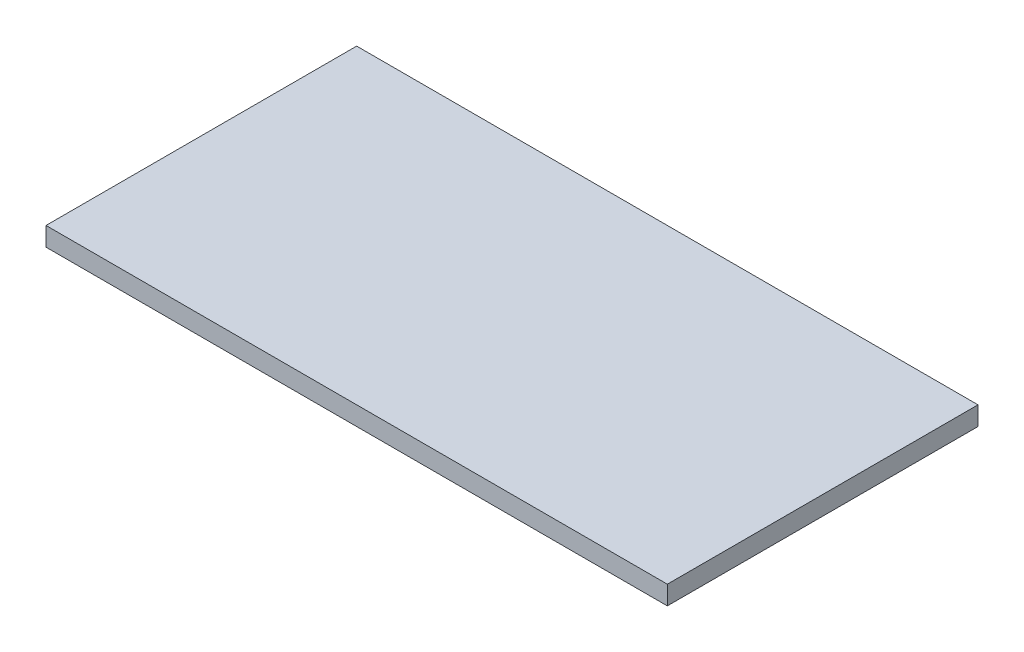
from build123d import *

# Parameters (mm, degrees)
BOSS_EXTRUDE1_DEPTH      = 3
BOSS_EXTRUDE1_DEPTH_BACK = 4
SKETCH1_W                = 15
SKETCH1_H                = 10
SKETCH2_R                = 2.3
CUT_EXTRUDE3_DEPTH       = 10
SKETCH2_4_R              = 3.025
SKETCH2_4_R_2            = 2.3
CUT_EXTRUDE4_DEPTH       = 2.6
CUT_EXTRUDE5_START       = 6.44
SKETCH2_5_R              = 3.025
SKETCH2_5_R_2            = 2.3
CUT_EXTRUDE5_DEPTH       = 3.56
SKETCH3_W                = 66
SKETCH3_H                = 33
BOSS_EXTRUDE2_DEPTH      = 2
FILLET2_R                = 3
FILLET3_R                = 3


with BuildPart() as part:
    # Sketch1 → Boss-Extrude1 (new, two sides: drawn at the far end of the back side and taken through both)
    with BuildSketch(Plane(origin=(0, 0, 0), x_dir=(1, 0, 0), z_dir=(0, 1, 0)).offset(-BOSS_EXTRUDE1_DEPTH_BACK)):
        with Locations((7.5, 0)):
            Rectangle(SKETCH1_W, SKETCH1_H)
    extrude(amount=BOSS_EXTRUDE1_DEPTH + BOSS_EXTRUDE1_DEPTH_BACK)

    # Sketch2 → Cut-Extrude3 (cut)
    with BuildSketch(Plane(origin=(0, 0, 0), x_dir=(0, 0, -1), z_dir=(1, 0, 0))):
        Circle(SKETCH2_R)
    extrude(amount=CUT_EXTRUDE3_DEPTH, mode=Mode.SUBTRACT)

    # Sketch2<4> → Cut-Extrude4 (cut)
    with BuildSketch(Plane(origin=(0, 0, 0), x_dir=(0, 0, -1), z_dir=(1, 0, 0))):
        Circle(SKETCH2_4_R)
        Circle(SKETCH2_4_R_2, mode=Mode.SUBTRACT)
    extrude(amount=CUT_EXTRUDE4_DEPTH, mode=Mode.SUBTRACT)

    # Sketch2<5> → Cut-Extrude5 (cut)
    with BuildSketch(Plane(origin=(0, 0, 0), x_dir=(0, 0, -1), z_dir=(1, 0, 0)).offset(CUT_EXTRUDE5_START)):
        Circle(SKETCH2_5_R)
        Circle(SKETCH2_5_R_2, mode=Mode.SUBTRACT)
    extrude(amount=CUT_EXTRUDE5_DEPTH, mode=Mode.SUBTRACT)

    # Fillet1: read off the stored shape, not the designer's step
    # Fillet1 outline → Fillet1 (revolve, cut)
    with BuildSketch(Plane.YX):
        with BuildLine():
            Line((2.3, 2.6), (3.025000061, 2.599999982))
            ThreePointArc((3.025000061, 2.599999982), (2.501564048, 2.959364472), (2.3, 3.561444226))
            Line((2.3, 3.561444226), (2.3, 2.6))
        make_face()
    revolve(axis=Axis((0, 0, 0), (1, 0, 0)), mode=Mode.SUBTRACT)

    # Sketch3 → Boss-Extrude2 (add)
    with BuildSketch(Plane(origin=(0, 3, 0), x_dir=(1, 0, 0), z_dir=(0, 1, 0))):
        with Locations((33, 0)):
            Rectangle(SKETCH3_W, SKETCH3_H)
    extrude(amount=BOSS_EXTRUDE2_DEPTH)

    # Fillet2
    fillet2_edges = [part.edges().sort_by_distance(p)[0] for p in [
        (7.5, 3, 5),
        (15, 3, 0),
        (7.5, 3, -5),
    ]]
    fillet(fillet2_edges, radius=FILLET2_R)

    # Fillet3
    fillet3_edges = [part.edges().sort_by_distance(p)[0] for p in [
        (15, -4, 0),
        (7.5, -4, -5),
        (7.5, -4, 5),
    ]]
    fillet(fillet3_edges, radius=FILLET3_R)


solid = part.part
